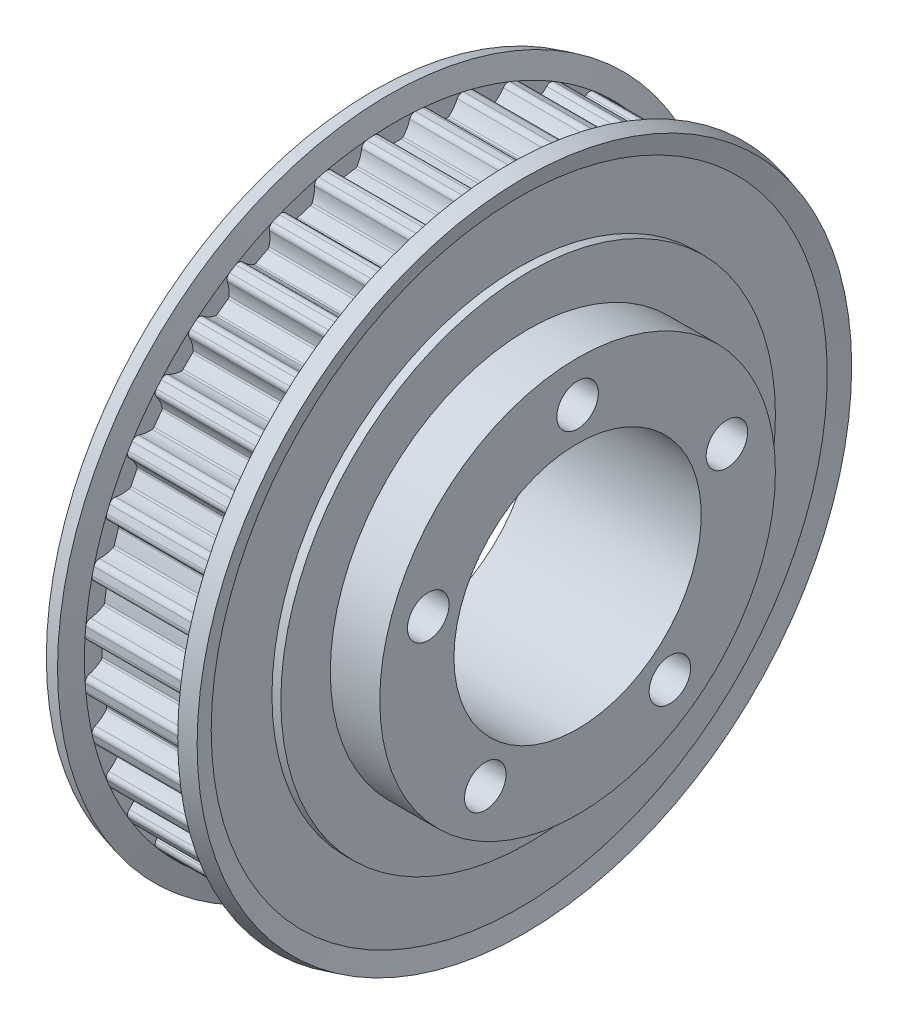
from build123d import *

# Parameters (mm, degrees)
SKETCH2_W             = 21
SKETCH2_H             = 12.5
CUT_EXTRUDE1_DEPTH    = 11
CUT_EXTRUDE2_DEPTH    = 11
CUT_EXTRUDE3_DEPTH    = 11
CUT_EXTRUDE4_DEPTH    = 11
CUT_EXTRUDE5_DEPTH    = 11
CUT_EXTRUDE6_DEPTH    = 11
CUT_EXTRUDE7_DEPTH    = 11
CUT_EXTRUDE8_DEPTH    = 11
CUT_EXTRUDE9_DEPTH    = 11
CUT_EXTRUDE10_DEPTH   = 11
CUT_EXTRUDE11_DEPTH   = 11
CUT_EXTRUDE12_DEPTH   = 11
CUT_EXTRUDE13_DEPTH   = 11
CUT_EXTRUDE14_DEPTH   = 11
CUT_EXTRUDE15_DEPTH   = 11
CUT_EXTRUDE16_DEPTH   = 11
CUT_EXTRUDE17_DEPTH   = 11
CUT_EXTRUDE18_DEPTH   = 11
CUT_EXTRUDE19_DEPTH   = 11
CUT_EXTRUDE20_DEPTH   = 11
CUT_EXTRUDE21_DEPTH   = 11
CUT_EXTRUDE22_DEPTH   = 11
CUT_EXTRUDE23_DEPTH   = 11
CUT_EXTRUDE24_DEPTH   = 11
CUT_EXTRUDE25_DEPTH   = 11
CUT_EXTRUDE26_DEPTH   = 11
CUT_EXTRUDE27_DEPTH   = 11
CUT_EXTRUDE28_DEPTH   = 11
CUT_EXTRUDE29_DEPTH   = 11
CUT_EXTRUDE30_DEPTH   = 11
CUT_EXTRUDE31_DEPTH   = 11
CUT_EXTRUDE32_DEPTH   = 11
CUT_EXTRUDE33_DEPTH   = 11
CUT_EXTRUDE34_DEPTH   = 11
CUT_EXTRUDE35_DEPTH   = 11
CUT_EXTRUDE36_DEPTH   = 11
CUT_EXTRUDE37_DEPTH   = 11
CUT_EXTRUDE38_DEPTH   = 11
CUT_EXTRUDE39_DEPTH   = 11
CUT_EXTRUDE40_DEPTH   = 11
SKETCH43_W            = 5
SKETCH43_H            = 3.5
M5X0_8_TAPPED_HOLE1_D = 4.2
CIRPATTERN1_COUNT     = 5
SKETCH47_R            = 21
CUT_EXTRUDE41_DEPTH   = 4


with BuildPart() as part:
    # Sketch1 → Revolve1 (revolve)
    with BuildSketch(Plane.XY):
        Polygon((0, 0), (0, 25), (0.9, 25), (0.9, 31.139356004), (0.378427914, 33.085889528), (1.923909236, 33.5), (2.5, 31.35), (13.5, 31.35), (14.076090764, 33.5), (15.621572086, 33.085889528), (15.1, 31.139356004), (15.1, 25), (16, 25), (16, 23.5), (21, 23.5), (21, 0), align=None)
    revolve(axis=Axis((21, 0, 0), (-1, 0, 0)))

    # Sketch2 → Cut-Revolve1 (revolve, cut)
    with BuildSketch(Plane.XY):
        with Locations((10.5, 6.25)):
            Rectangle(SKETCH2_W, SKETCH2_H)
    revolve(axis=Axis((21, 0, 0), (-1, 0, 0)), mode=Mode.SUBTRACT)

    # Sketch3 → Cut-Extrude1 (cut)
    with BuildSketch(Plane(origin=(2.5, 0, 0), x_dir=(0, 0, -1), z_dir=(1, 0, 0))):
        with BuildLine():
            Line((2.087720208, 31.280407995), (2.087720208, 31.761459732))
            ThreePointArc((2.087720208, 31.761459732), (0, 31.83), (-2.087720208, 31.761459732))
            Line((-2.087720208, 31.761459732), (-2.087720208, 31.280407995))
            ThreePointArc((-2.087720208, 31.280407995), (-1.735068973, 31.181771634), (-1.522504924, 30.883596266))
            ThreePointArc((-1.522504924, 30.883596266), (-1.258864332, 30.23641307), (-0.863917433, 29.659898198))
            ThreePointArc((-0.863917433, 29.659898198), (-0.775941477, 29.594148784), (-0.668275681, 29.572450146))
            ThreePointArc((-0.668275681, 29.572450146), (9e-09, 29.58), (0.668275699, 29.572450145))
            ThreePointArc((0.668275699, 29.572450145), (0.775941485, 29.594148787), (0.863917433, 29.659898198))
            ThreePointArc((0.863917433, 29.659898198), (1.258864332, 30.23641307), (1.522504924, 30.883596266))
            ThreePointArc((1.522504924, 30.883596266), (1.735068973, 31.181771634), (2.087720208, 31.280407995))
        make_face()
    extrude(amount=CUT_EXTRUDE1_DEPTH, mode=Mode.SUBTRACT)

    # Sketch4 → Cut-Extrude2 (cut)
    with BuildSketch(Plane(origin=(2.5, 0, 0), x_dir=(0, 0, -1), z_dir=(1, 0, 0))):
        with BuildLine():
            Line((6.955350799, 30.568702872), (7.03060387, 31.043832064))
            ThreePointArc((7.03060387, 31.043832064), (4.979309022, 31.438119881), (2.906570055, 31.697014852))
            Line((2.906570055, 31.697014852), (2.831316983, 31.22188566))
            ThreePointArc((2.831316983, 31.22188566), (3.16419637, 31.069296869), (3.327498498, 30.741540191))
            ThreePointArc((3.327498498, 30.741540191), (3.48665148, 30.061082419), (3.786549132, 29.429882095))
            ThreePointArc((3.786549132, 29.429882095), (3.863156484, 29.351179693), (3.96610232, 29.31290556))
            ThreePointArc((3.96610232, 29.31290556), (4.627331485, 29.215821113), (5.286198535, 29.10382286))
            ThreePointArc((5.286198535, 29.10382286), (5.395933191, 29.108411716), (5.493111483, 29.159589172))
            ThreePointArc((5.493111483, 29.159589172), (5.973382727, 29.667222882), (6.335019222, 30.265195704))
            ThreePointArc((6.335019222, 30.265195704), (6.591611159, 30.526447696), (6.955350799, 30.568702872))
        make_face()
    extrude(amount=CUT_EXTRUDE2_DEPTH, mode=Mode.SUBTRACT)

    # Sketch5 → Cut-Extrude3 (cut)
    with BuildSketch(Plane(origin=(2.5, 0, 0), x_dir=(0, 0, -1), z_dir=(1, 0, 0))):
        with BuildLine():
            Line((11.651717569, 29.104294832), (11.800370731, 29.561802222))
            ThreePointArc((11.800370731, 29.561802222), (9.836010931, 30.272128914), (7.829290916, 30.852084269))
            Line((7.829290916, 30.852084269), (7.680637754, 30.39457688))
            ThreePointArc((7.680637754, 30.39457688), (7.985548697, 30.191792901), (8.095567864, 29.842525371))
            ThreePointArc((8.095567864, 29.842525371), (8.146314361, 29.145548152), (8.343778291, 28.475204623))
            ThreePointArc((8.343778291, 28.475204623), (8.407130711, 28.385487148), (8.502821719, 28.331579956))
            ThreePointArc((8.502821719, 28.331579956), (9.140722702, 28.132251749), (9.773957618, 27.918562865))
            ThreePointArc((9.773957618, 27.918562865), (9.883059115, 27.905928943), (9.987046899, 27.941274286))
            ThreePointArc((9.987046899, 27.941274286), (10.540816614, 28.367527207), (10.991544323, 28.901565579))
            ThreePointArc((10.991544323, 28.901565579), (11.285846002, 29.119461303), (11.651717569, 29.104294832))
        make_face()
    extrude(amount=CUT_EXTRUDE3_DEPTH, mode=Mode.SUBTRACT)

    # Sketch6 → Cut-Extrude4 (cut)
    with BuildSketch(Plane(origin=(2.5, 0, 0), x_dir=(0, 0, -1), z_dir=(1, 0, 0))):
        with BuildLine():
            Line((16.061180383, 26.923242462), (16.279573302, 27.351862699))
            ThreePointArc((16.279573302, 27.351862699), (14.450517607, 28.360737665), (12.559228651, 29.24747298))
            Line((12.559228651, 29.24747298), (12.340835732, 28.818852743))
            ThreePointArc((12.340835732, 28.818852743), (12.610270312, 28.570866792), (12.664297482, 28.208688534))
            ThreePointArc((12.664297482, 28.208688534), (12.605387947, 27.512353761), (12.695555936, 26.819373109))
            ThreePointArc((12.695555936, 26.819373109), (12.744093478, 26.720849703), (12.830173428, 26.652636826))
            ThreePointArc((12.830173428, 26.652636826), (13.42903899, 26.355972981), (14.021049428, 26.045855197))
            ThreePointArc((14.021049428, 26.045855197), (14.126831323, 26.016309585), (14.235068074, 26.034952494))
            ThreePointArc((14.235068074, 26.034952494), (14.848700613, 26.369328866), (15.377421123, 26.826282992))
            ThreePointArc((15.377421123, 26.826282992), (15.702185862, 26.995457132), (16.061180383, 26.923242462))
        make_face()
    extrude(amount=CUT_EXTRUDE4_DEPTH, mode=Mode.SUBTRACT)

    # Sketch7 → Cut-Extrude5 (cut)
    with BuildSketch(Plane(origin=(2.5, 0, 0), x_dir=(0, 0, -1), z_dir=(1, 0, 0))):
        with BuildLine():
            Line((20.075163633, 24.07925051), (20.35791875, 24.468429541))
            ThreePointArc((20.35791875, 24.468429541), (18.70920458, 25.751010931), (16.979916494, 26.922691839))
            Line((16.979916494, 26.922691839), (16.697161378, 26.533512808))
            ThreePointArc((16.697161378, 26.533512808), (16.924485222, 26.246431121), (16.921190065, 25.880260167))
            ThreePointArc((16.921190065, 25.880260167), (16.754075046, 25.201713912), (16.73472686, 24.50315962))
            ThreePointArc((16.73472686, 24.50315962), (16.767254368, 24.398256257), (16.841603687, 24.317417323))
            ThreePointArc((16.841603687, 24.317417323), (17.38668777, 23.930722688), (17.922896467, 23.531812132))
            ThreePointArc((17.922896467, 23.531812132), (18.022754059, 23.486082341), (18.13257463, 23.487563768))
            ThreePointArc((18.13257463, 23.487563768), (18.790960323, 23.721830133), (19.38465478, 24.090448285))
            ThreePointArc((19.38465478, 24.090448285), (19.731885792, 24.206735213), (20.075163633, 24.07925051))
        make_face()
    extrude(amount=CUT_EXTRUDE5_DEPTH, mode=Mode.SUBTRACT)

    # Sketch8 → Cut-Extrude6 (cut)
    with BuildSketch(Plane(origin=(2.5, 0, 0), x_dir=(0, 0, -1), z_dir=(1, 0, 0))):
        with BuildLine():
            Line((23.594829728, 20.642347495), (23.934984673, 20.982502441))
            ThreePointArc((23.934984673, 20.982502441), (22.507208845, 22.507208845), (20.982502441, 23.934984673))
            Line((20.982502441, 23.934984673), (20.642347495, 23.594829728))
            ThreePointArc((20.642347495, 23.594829728), (20.821963136, 23.275721208), (20.761426791, 22.914573903))
            ThreePointArc((20.761426791, 22.914573903), (20.490221215, 22.270524226), (20.36183327, 21.58359702))
            ThreePointArc((20.36183327, 21.58359702), (20.377549808, 21.474896768), (20.438337768, 21.3834223))
            ThreePointArc((20.438337768, 21.3834223), (20.916218594, 20.916218581), (21.383422312, 20.438337755))
            ThreePointArc((21.383422312, 20.438337755), (21.474896777, 20.377549805), (21.58359702, 20.36183327))
            ThreePointArc((21.58359702, 20.36183327), (22.270524226, 20.490221215), (22.914573903, 20.761426791))
            ThreePointArc((22.914573903, 20.761426791), (23.275721208, 20.821963136), (23.594829728, 20.642347495))
        make_face()
    extrude(amount=CUT_EXTRUDE6_DEPTH, mode=Mode.SUBTRACT)

    # Sketch9 → Cut-Extrude7 (cut)
    with BuildSketch(Plane(origin=(2.5, 0, 0), x_dir=(0, 0, -1), z_dir=(1, 0, 0))):
        with BuildLine():
            Line((26.533512808, 16.697161378), (26.922691839, 16.979916494))
            ThreePointArc((26.922691839, 16.979916494), (25.751010931, 18.70920458), (24.468429541, 20.35791875))
            Line((24.468429541, 20.35791875), (24.07925051, 20.075163633))
            ThreePointArc((24.07925051, 20.075163633), (24.206735213, 19.731885792), (24.090448285, 19.38465478))
            ThreePointArc((24.090448285, 19.38465478), (23.721830133, 18.790960323), (23.487563768, 18.13257463))
            ThreePointArc((23.487563768, 18.13257463), (23.486082343, 18.02275405), (23.531812143, 17.922896453))
            ThreePointArc((23.531812143, 17.922896453), (23.930722699, 17.386687756), (24.317417333, 16.841603672))
            ThreePointArc((24.317417333, 16.841603672), (24.398256264, 16.767254363), (24.50315962, 16.73472686))
            ThreePointArc((24.50315962, 16.73472686), (25.201713912, 16.754075046), (25.880260167, 16.921190065))
            ThreePointArc((25.880260167, 16.921190065), (26.246431121, 16.924485222), (26.533512808, 16.697161378))
        make_face()
    extrude(amount=CUT_EXTRUDE7_DEPTH, mode=Mode.SUBTRACT)

    # Sketch10 → Cut-Extrude8 (cut)
    with BuildSketch(Plane(origin=(2.5, 0, 0), x_dir=(0, 0, -1), z_dir=(1, 0, 0))):
        with BuildLine():
            Line((28.818852743, 12.340835732), (29.24747298, 12.559228651))
            ThreePointArc((29.24747298, 12.559228651), (28.360737665, 14.450517607), (27.351862699, 16.279573302))
            Line((27.351862699, 16.279573302), (26.923242462, 16.061180383))
            ThreePointArc((26.923242462, 16.061180383), (26.995457132, 15.702185862), (26.826282992, 15.377421123))
            ThreePointArc((26.826282992, 15.377421123), (26.369328866, 14.848700613), (26.034952494, 14.235068074))
            ThreePointArc((26.034952494, 14.235068074), (26.016309585, 14.126831314), (26.045855205, 14.021049412))
            ThreePointArc((26.045855205, 14.021049412), (26.35597299, 13.429038974), (26.652636834, 12.830173412))
            ThreePointArc((26.652636834, 12.830173412), (26.72084971, 12.744093472), (26.819373109, 12.695555936))
            ThreePointArc((26.819373109, 12.695555936), (27.512353761, 12.605387947), (28.208688534, 12.664297482))
            ThreePointArc((28.208688534, 12.664297482), (28.570866792, 12.610270312), (28.818852743, 12.340835732))
        make_face()
    extrude(amount=CUT_EXTRUDE8_DEPTH, mode=Mode.SUBTRACT)

    # Sketch11 → Cut-Extrude9 (cut)
    with BuildSketch(Plane(origin=(2.5, 0, 0), x_dir=(0, 0, -1), z_dir=(1, 0, 0))):
        with BuildLine():
            Line((30.39457688, 7.680637754), (30.852084269, 7.829290916))
            ThreePointArc((30.852084269, 7.829290916), (30.272128914, 9.836010931), (29.561802222, 11.800370731))
            Line((29.561802222, 11.800370731), (29.104294832, 11.651717569))
            ThreePointArc((29.104294832, 11.651717569), (29.119461303, 11.285846002), (28.901565579, 10.991544323))
            ThreePointArc((28.901565579, 10.991544323), (28.367527207, 10.540816614), (27.941274286, 9.987046899))
            ThreePointArc((27.941274286, 9.987046899), (27.905928942, 9.883059106), (27.918562871, 9.773957602))
            ThreePointArc((27.918562871, 9.773957602), (28.132251755, 9.140722685), (28.331579961, 8.502821702))
            ThreePointArc((28.331579961, 8.502821702), (28.385487154, 8.407130704), (28.475204623, 8.343778291))
            ThreePointArc((28.475204623, 8.343778291), (29.145548152, 8.146314361), (29.842525371, 8.095567864))
            ThreePointArc((29.842525371, 8.095567864), (30.191792901, 7.985548697), (30.39457688, 7.680637754))
        make_face()
    extrude(amount=CUT_EXTRUDE9_DEPTH, mode=Mode.SUBTRACT)

    # Sketch12 → Cut-Extrude10 (cut)
    with BuildSketch(Plane(origin=(2.5, 0, 0), x_dir=(0, 0, -1), z_dir=(1, 0, 0))):
        with BuildLine():
            Line((31.22188566, 2.831316983), (31.697014852, 2.906570055))
            ThreePointArc((31.697014852, 2.906570055), (31.438119881, 4.979309022), (31.043832064, 7.03060387))
            Line((31.043832064, 7.03060387), (30.568702872, 6.955350799))
            ThreePointArc((30.568702872, 6.955350799), (30.526447696, 6.591611159), (30.265195704, 6.335019222))
            ThreePointArc((30.265195704, 6.335019222), (29.667222882, 5.973382727), (29.159589172, 5.493111483))
            ThreePointArc((29.159589172, 5.493111483), (29.108411714, 5.395933183), (29.103822863, 5.286198517))
            ThreePointArc((29.103822863, 5.286198517), (29.215821116, 4.627331467), (29.312905563, 3.966102302))
            ThreePointArc((29.312905563, 3.966102302), (29.351179698, 3.863156476), (29.429882095, 3.786549132))
            ThreePointArc((29.429882095, 3.786549132), (30.061082419, 3.48665148), (30.741540191, 3.327498498))
            ThreePointArc((30.741540191, 3.327498498), (31.069296869, 3.16419637), (31.22188566, 2.831316983))
        make_face()
    extrude(amount=CUT_EXTRUDE10_DEPTH, mode=Mode.SUBTRACT)

    # Sketch13 → Cut-Extrude11 (cut)
    with BuildSketch(Plane(origin=(2.5, 0, 0), x_dir=(0, 0, -1), z_dir=(1, 0, 0))):
        with BuildLine():
            Line((31.280407995, -2.087720208), (31.761459732, -2.087720208))
            ThreePointArc((31.761459732, -2.087720208), (31.83, 0), (31.761459732, 2.087720208))
            Line((31.761459732, 2.087720208), (31.280407995, 2.087720208))
            ThreePointArc((31.280407995, 2.087720208), (31.181771634, 1.735068973), (30.883596266, 1.522504924))
            ThreePointArc((30.883596266, 1.522504924), (30.23641307, 1.258864332), (29.659898198, 0.863917433))
            ThreePointArc((29.659898198, 0.863917433), (29.594148784, 0.775941477), (29.572450146, 0.668275681))
            ThreePointArc((29.572450146, 0.668275681), (29.58, -9e-09), (29.572450145, -0.668275699))
            ThreePointArc((29.572450145, -0.668275699), (29.594148787, -0.775941485), (29.659898198, -0.863917433))
            ThreePointArc((29.659898198, -0.863917433), (30.23641307, -1.258864332), (30.883596266, -1.522504924))
            ThreePointArc((30.883596266, -1.522504924), (31.181771634, -1.735068973), (31.280407995, -2.087720208))
        make_face()
    extrude(amount=CUT_EXTRUDE11_DEPTH, mode=Mode.SUBTRACT)

    # Sketch14 → Cut-Extrude12 (cut)
    with BuildSketch(Plane(origin=(2.5, 0, 0), x_dir=(0, 0, -1), z_dir=(1, 0, 0))):
        with BuildLine():
            Line((30.568702872, -6.955350799), (31.043832064, -7.03060387))
            ThreePointArc((31.043832064, -7.03060387), (31.438119881, -4.979309022), (31.697014852, -2.906570055))
            Line((31.697014852, -2.906570055), (31.22188566, -2.831316983))
            ThreePointArc((31.22188566, -2.831316983), (31.069296869, -3.16419637), (30.741540191, -3.327498498))
            ThreePointArc((30.741540191, -3.327498498), (30.061082419, -3.48665148), (29.429882095, -3.786549132))
            ThreePointArc((29.429882095, -3.786549132), (29.351179693, -3.863156484), (29.31290556, -3.96610232))
            ThreePointArc((29.31290556, -3.96610232), (29.215821113, -4.627331485), (29.10382286, -5.286198535))
            ThreePointArc((29.10382286, -5.286198535), (29.108411716, -5.395933191), (29.159589172, -5.493111483))
            ThreePointArc((29.159589172, -5.493111483), (29.667222882, -5.973382727), (30.265195704, -6.335019222))
            ThreePointArc((30.265195704, -6.335019222), (30.526447696, -6.591611159), (30.568702872, -6.955350799))
        make_face()
    extrude(amount=CUT_EXTRUDE12_DEPTH, mode=Mode.SUBTRACT)

    # Sketch15 → Cut-Extrude13 (cut)
    with BuildSketch(Plane(origin=(2.5, 0, 0), x_dir=(0, 0, -1), z_dir=(1, 0, 0))):
        with BuildLine():
            Line((29.104294832, -11.651717569), (29.561802222, -11.800370731))
            ThreePointArc((29.561802222, -11.800370731), (30.272128914, -9.836010931), (30.852084269, -7.829290916))
            Line((30.852084269, -7.829290916), (30.39457688, -7.680637754))
            ThreePointArc((30.39457688, -7.680637754), (30.191792901, -7.985548697), (29.842525371, -8.095567864))
            ThreePointArc((29.842525371, -8.095567864), (29.145548152, -8.146314361), (28.475204623, -8.343778291))
            ThreePointArc((28.475204623, -8.343778291), (28.385487148, -8.407130711), (28.331579956, -8.502821719))
            ThreePointArc((28.331579956, -8.502821719), (28.132251749, -9.140722702), (27.918562865, -9.773957618))
            ThreePointArc((27.918562865, -9.773957618), (27.905928943, -9.883059115), (27.941274286, -9.987046899))
            ThreePointArc((27.941274286, -9.987046899), (28.367527207, -10.540816614), (28.901565579, -10.991544323))
            ThreePointArc((28.901565579, -10.991544323), (29.119461303, -11.285846002), (29.104294832, -11.651717569))
        make_face()
    extrude(amount=CUT_EXTRUDE13_DEPTH, mode=Mode.SUBTRACT)

    # Sketch16 → Cut-Extrude14 (cut)
    with BuildSketch(Plane(origin=(2.5, 0, 0), x_dir=(0, 0, -1), z_dir=(1, 0, 0))):
        with BuildLine():
            Line((26.923242462, -16.061180383), (27.351862699, -16.279573302))
            ThreePointArc((27.351862699, -16.279573302), (28.360737665, -14.450517607), (29.24747298, -12.559228651))
            Line((29.24747298, -12.559228651), (28.818852743, -12.340835732))
            ThreePointArc((28.818852743, -12.340835732), (28.570866792, -12.610270312), (28.208688534, -12.664297482))
            ThreePointArc((28.208688534, -12.664297482), (27.512353761, -12.605387947), (26.819373109, -12.695555936))
            ThreePointArc((26.819373109, -12.695555936), (26.720849703, -12.744093478), (26.652636826, -12.830173428))
            ThreePointArc((26.652636826, -12.830173428), (26.355972981, -13.42903899), (26.045855197, -14.021049428))
            ThreePointArc((26.045855197, -14.021049428), (26.016309585, -14.126831323), (26.034952494, -14.235068074))
            ThreePointArc((26.034952494, -14.235068074), (26.369328866, -14.848700613), (26.826282992, -15.377421123))
            ThreePointArc((26.826282992, -15.377421123), (26.995457132, -15.702185862), (26.923242462, -16.061180383))
        make_face()
    extrude(amount=CUT_EXTRUDE14_DEPTH, mode=Mode.SUBTRACT)

    # Sketch17 → Cut-Extrude15 (cut)
    with BuildSketch(Plane(origin=(2.5, 0, 0), x_dir=(0, 0, -1), z_dir=(1, 0, 0))):
        with BuildLine():
            Line((24.07925051, -20.075163633), (24.468429541, -20.35791875))
            ThreePointArc((24.468429541, -20.35791875), (25.751010931, -18.70920458), (26.922691839, -16.979916494))
            Line((26.922691839, -16.979916494), (26.533512808, -16.697161378))
            ThreePointArc((26.533512808, -16.697161378), (26.246431121, -16.924485222), (25.880260167, -16.921190065))
            ThreePointArc((25.880260167, -16.921190065), (25.201713912, -16.754075046), (24.50315962, -16.73472686))
            ThreePointArc((24.50315962, -16.73472686), (24.398256257, -16.767254368), (24.317417323, -16.841603687))
            ThreePointArc((24.317417323, -16.841603687), (23.930722688, -17.38668777), (23.531812132, -17.922896467))
            ThreePointArc((23.531812132, -17.922896467), (23.486082341, -18.022754059), (23.487563768, -18.13257463))
            ThreePointArc((23.487563768, -18.13257463), (23.721830133, -18.790960323), (24.090448285, -19.38465478))
            ThreePointArc((24.090448285, -19.38465478), (24.206735213, -19.731885792), (24.07925051, -20.075163633))
        make_face()
    extrude(amount=CUT_EXTRUDE15_DEPTH, mode=Mode.SUBTRACT)

    # Sketch18 → Cut-Extrude16 (cut)
    with BuildSketch(Plane(origin=(2.5, 0, 0), x_dir=(0, 0, -1), z_dir=(1, 0, 0))):
        with BuildLine():
            Line((20.642347495, -23.594829728), (20.982502441, -23.934984673))
            ThreePointArc((20.982502441, -23.934984673), (22.507208845, -22.507208845), (23.934984673, -20.982502441))
            Line((23.934984673, -20.982502441), (23.594829728, -20.642347495))
            ThreePointArc((23.594829728, -20.642347495), (23.275721208, -20.821963136), (22.914573903, -20.761426791))
            ThreePointArc((22.914573903, -20.761426791), (22.270524226, -20.490221215), (21.58359702, -20.36183327))
            ThreePointArc((21.58359702, -20.36183327), (21.474896768, -20.377549808), (21.3834223, -20.438337768))
            ThreePointArc((21.3834223, -20.438337768), (20.916218581, -20.916218594), (20.438337755, -21.383422312))
            ThreePointArc((20.438337755, -21.383422312), (20.377549805, -21.474896777), (20.36183327, -21.58359702))
            ThreePointArc((20.36183327, -21.58359702), (20.490221215, -22.270524226), (20.761426791, -22.914573903))
            ThreePointArc((20.761426791, -22.914573903), (20.821963136, -23.275721208), (20.642347495, -23.594829728))
        make_face()
    extrude(amount=CUT_EXTRUDE16_DEPTH, mode=Mode.SUBTRACT)

    # Sketch19 → Cut-Extrude17 (cut)
    with BuildSketch(Plane(origin=(2.5, 0, 0), x_dir=(0, 0, -1), z_dir=(1, 0, 0))):
        with BuildLine():
            Line((16.697161378, -26.533512808), (16.979916494, -26.922691839))
            ThreePointArc((16.979916494, -26.922691839), (18.70920458, -25.751010931), (20.35791875, -24.468429541))
            Line((20.35791875, -24.468429541), (20.075163633, -24.07925051))
            ThreePointArc((20.075163633, -24.07925051), (19.731885792, -24.206735213), (19.38465478, -24.090448285))
            ThreePointArc((19.38465478, -24.090448285), (18.790960323, -23.721830133), (18.13257463, -23.487563768))
            ThreePointArc((18.13257463, -23.487563768), (18.02275405, -23.486082343), (17.922896453, -23.531812143))
            ThreePointArc((17.922896453, -23.531812143), (17.386687756, -23.930722699), (16.841603672, -24.317417333))
            ThreePointArc((16.841603672, -24.317417333), (16.767254363, -24.398256264), (16.73472686, -24.50315962))
            ThreePointArc((16.73472686, -24.50315962), (16.754075046, -25.201713912), (16.921190065, -25.880260167))
            ThreePointArc((16.921190065, -25.880260167), (16.924485222, -26.246431121), (16.697161378, -26.533512808))
        make_face()
    extrude(amount=CUT_EXTRUDE17_DEPTH, mode=Mode.SUBTRACT)

    # Sketch20 → Cut-Extrude18 (cut)
    with BuildSketch(Plane(origin=(2.5, 0, 0), x_dir=(0, 0, -1), z_dir=(1, 0, 0))):
        with BuildLine():
            Line((12.340835732, -28.818852743), (12.559228651, -29.24747298))
            ThreePointArc((12.559228651, -29.24747298), (14.450517607, -28.360737665), (16.279573302, -27.351862699))
            Line((16.279573302, -27.351862699), (16.061180383, -26.923242462))
            ThreePointArc((16.061180383, -26.923242462), (15.702185862, -26.995457132), (15.377421123, -26.826282992))
            ThreePointArc((15.377421123, -26.826282992), (14.848700613, -26.369328866), (14.235068074, -26.034952494))
            ThreePointArc((14.235068074, -26.034952494), (14.126831314, -26.016309585), (14.021049412, -26.045855205))
            ThreePointArc((14.021049412, -26.045855205), (13.429038974, -26.35597299), (12.830173412, -26.652636834))
            ThreePointArc((12.830173412, -26.652636834), (12.744093472, -26.72084971), (12.695555936, -26.819373109))
            ThreePointArc((12.695555936, -26.819373109), (12.605387947, -27.512353761), (12.664297482, -28.208688534))
            ThreePointArc((12.664297482, -28.208688534), (12.610270312, -28.570866792), (12.340835732, -28.818852743))
        make_face()
    extrude(amount=CUT_EXTRUDE18_DEPTH, mode=Mode.SUBTRACT)

    # Sketch21 → Cut-Extrude19 (cut)
    with BuildSketch(Plane(origin=(2.5, 0, 0), x_dir=(0, 0, -1), z_dir=(1, 0, 0))):
        with BuildLine():
            Line((7.680637754, -30.39457688), (7.829290916, -30.852084269))
            ThreePointArc((7.829290916, -30.852084269), (9.836010931, -30.272128914), (11.800370731, -29.561802222))
            Line((11.800370731, -29.561802222), (11.651717569, -29.104294832))
            ThreePointArc((11.651717569, -29.104294832), (11.285846002, -29.119461303), (10.991544323, -28.901565579))
            ThreePointArc((10.991544323, -28.901565579), (10.540816614, -28.367527207), (9.987046899, -27.941274286))
            ThreePointArc((9.987046899, -27.941274286), (9.883059106, -27.905928942), (9.773957602, -27.918562871))
            ThreePointArc((9.773957602, -27.918562871), (9.140722685, -28.132251755), (8.502821702, -28.331579961))
            ThreePointArc((8.502821702, -28.331579961), (8.407130704, -28.385487154), (8.343778291, -28.475204623))
            ThreePointArc((8.343778291, -28.475204623), (8.146314361, -29.145548152), (8.095567864, -29.842525371))
            ThreePointArc((8.095567864, -29.842525371), (7.985548697, -30.191792901), (7.680637754, -30.39457688))
        make_face()
    extrude(amount=CUT_EXTRUDE19_DEPTH, mode=Mode.SUBTRACT)

    # Sketch22 → Cut-Extrude20 (cut)
    with BuildSketch(Plane(origin=(2.5, 0, 0), x_dir=(0, 0, -1), z_dir=(1, 0, 0))):
        with BuildLine():
            Line((2.831316983, -31.22188566), (2.906570055, -31.697014852))
            ThreePointArc((2.906570055, -31.697014852), (4.979309022, -31.438119881), (7.03060387, -31.043832064))
            Line((7.03060387, -31.043832064), (6.955350799, -30.568702872))
            ThreePointArc((6.955350799, -30.568702872), (6.591611159, -30.526447696), (6.335019222, -30.265195704))
            ThreePointArc((6.335019222, -30.265195704), (5.973382727, -29.667222882), (5.493111483, -29.159589172))
            ThreePointArc((5.493111483, -29.159589172), (5.395933183, -29.108411714), (5.286198517, -29.103822863))
            ThreePointArc((5.286198517, -29.103822863), (4.627331467, -29.215821116), (3.966102302, -29.312905563))
            ThreePointArc((3.966102302, -29.312905563), (3.863156476, -29.351179698), (3.786549132, -29.429882095))
            ThreePointArc((3.786549132, -29.429882095), (3.48665148, -30.061082419), (3.327498498, -30.741540191))
            ThreePointArc((3.327498498, -30.741540191), (3.16419637, -31.069296869), (2.831316983, -31.22188566))
        make_face()
    extrude(amount=CUT_EXTRUDE20_DEPTH, mode=Mode.SUBTRACT)

    # Sketch23 → Cut-Extrude21 (cut)
    with BuildSketch(Plane(origin=(2.5, 0, 0), x_dir=(0, 0, -1), z_dir=(1, 0, 0))):
        with BuildLine():
            Line((-2.087720208, -31.280407995), (-2.087720208, -31.761459732))
            ThreePointArc((-2.087720208, -31.761459732), (0, -31.83), (2.087720208, -31.761459732))
            Line((2.087720208, -31.761459732), (2.087720208, -31.280407995))
            ThreePointArc((2.087720208, -31.280407995), (1.735068973, -31.181771634), (1.522504924, -30.883596266))
            ThreePointArc((1.522504924, -30.883596266), (1.258864332, -30.23641307), (0.863917433, -29.659898198))
            ThreePointArc((0.863917433, -29.659898198), (0.775941477, -29.594148784), (0.668275681, -29.572450146))
            ThreePointArc((0.668275681, -29.572450146), (-9e-09, -29.58), (-0.668275699, -29.572450145))
            ThreePointArc((-0.668275699, -29.572450145), (-0.775941485, -29.594148787), (-0.863917433, -29.659898198))
            ThreePointArc((-0.863917433, -29.659898198), (-1.258864332, -30.23641307), (-1.522504924, -30.883596266))
            ThreePointArc((-1.522504924, -30.883596266), (-1.735068973, -31.181771634), (-2.087720208, -31.280407995))
        make_face()
    extrude(amount=CUT_EXTRUDE21_DEPTH, mode=Mode.SUBTRACT)

    # Sketch24 → Cut-Extrude22 (cut)
    with BuildSketch(Plane(origin=(2.5, 0, 0), x_dir=(0, 0, -1), z_dir=(1, 0, 0))):
        with BuildLine():
            Line((-6.955350799, -30.568702872), (-7.03060387, -31.043832064))
            ThreePointArc((-7.03060387, -31.043832064), (-4.979309022, -31.438119881), (-2.906570055, -31.697014852))
            Line((-2.906570055, -31.697014852), (-2.831316983, -31.22188566))
            ThreePointArc((-2.831316983, -31.22188566), (-3.16419637, -31.069296869), (-3.327498498, -30.741540191))
            ThreePointArc((-3.327498498, -30.741540191), (-3.48665148, -30.061082419), (-3.786549132, -29.429882095))
            ThreePointArc((-3.786549132, -29.429882095), (-3.863156484, -29.351179693), (-3.96610232, -29.31290556))
            ThreePointArc((-3.96610232, -29.31290556), (-4.627331485, -29.215821113), (-5.286198535, -29.10382286))
            ThreePointArc((-5.286198535, -29.10382286), (-5.395933191, -29.108411716), (-5.493111483, -29.159589172))
            ThreePointArc((-5.493111483, -29.159589172), (-5.973382727, -29.667222882), (-6.335019222, -30.265195704))
            ThreePointArc((-6.335019222, -30.265195704), (-6.591611159, -30.526447696), (-6.955350799, -30.568702872))
        make_face()
    extrude(amount=CUT_EXTRUDE22_DEPTH, mode=Mode.SUBTRACT)

    # Sketch25 → Cut-Extrude23 (cut)
    with BuildSketch(Plane(origin=(2.5, 0, 0), x_dir=(0, 0, -1), z_dir=(1, 0, 0))):
        with BuildLine():
            Line((-11.651717569, -29.104294832), (-11.800370731, -29.561802222))
            ThreePointArc((-11.800370731, -29.561802222), (-9.836010931, -30.272128914), (-7.829290916, -30.852084269))
            Line((-7.829290916, -30.852084269), (-7.680637754, -30.39457688))
            ThreePointArc((-7.680637754, -30.39457688), (-7.985548697, -30.191792901), (-8.095567864, -29.842525371))
            ThreePointArc((-8.095567864, -29.842525371), (-8.146314361, -29.145548152), (-8.343778291, -28.475204623))
            ThreePointArc((-8.343778291, -28.475204623), (-8.407130711, -28.385487148), (-8.502821719, -28.331579956))
            ThreePointArc((-8.502821719, -28.331579956), (-9.140722702, -28.132251749), (-9.773957618, -27.918562865))
            ThreePointArc((-9.773957618, -27.918562865), (-9.883059115, -27.905928943), (-9.987046899, -27.941274286))
            ThreePointArc((-9.987046899, -27.941274286), (-10.540816614, -28.367527207), (-10.991544323, -28.901565579))
            ThreePointArc((-10.991544323, -28.901565579), (-11.285846002, -29.119461303), (-11.651717569, -29.104294832))
        make_face()
    extrude(amount=CUT_EXTRUDE23_DEPTH, mode=Mode.SUBTRACT)

    # Sketch26 → Cut-Extrude24 (cut)
    with BuildSketch(Plane(origin=(2.5, 0, 0), x_dir=(0, 0, -1), z_dir=(1, 0, 0))):
        with BuildLine():
            Line((-16.061180383, -26.923242462), (-16.279573302, -27.351862699))
            ThreePointArc((-16.279573302, -27.351862699), (-14.450517607, -28.360737665), (-12.559228651, -29.24747298))
            Line((-12.559228651, -29.24747298), (-12.340835732, -28.818852743))
            ThreePointArc((-12.340835732, -28.818852743), (-12.610270312, -28.570866792), (-12.664297482, -28.208688534))
            ThreePointArc((-12.664297482, -28.208688534), (-12.605387947, -27.512353761), (-12.695555936, -26.819373109))
            ThreePointArc((-12.695555936, -26.819373109), (-12.744093478, -26.720849703), (-12.830173428, -26.652636826))
            ThreePointArc((-12.830173428, -26.652636826), (-13.42903899, -26.355972981), (-14.021049428, -26.045855197))
            ThreePointArc((-14.021049428, -26.045855197), (-14.126831323, -26.016309585), (-14.235068074, -26.034952494))
            ThreePointArc((-14.235068074, -26.034952494), (-14.848700613, -26.369328866), (-15.377421123, -26.826282992))
            ThreePointArc((-15.377421123, -26.826282992), (-15.702185862, -26.995457132), (-16.061180383, -26.923242462))
        make_face()
    extrude(amount=CUT_EXTRUDE24_DEPTH, mode=Mode.SUBTRACT)

    # Sketch27 → Cut-Extrude25 (cut)
    with BuildSketch(Plane(origin=(2.5, 0, 0), x_dir=(0, 0, -1), z_dir=(1, 0, 0))):
        with BuildLine():
            Line((-20.075163633, -24.07925051), (-20.35791875, -24.468429541))
            ThreePointArc((-20.35791875, -24.468429541), (-18.70920458, -25.751010931), (-16.979916494, -26.922691839))
            Line((-16.979916494, -26.922691839), (-16.697161378, -26.533512808))
            ThreePointArc((-16.697161378, -26.533512808), (-16.924485222, -26.246431121), (-16.921190065, -25.880260167))
            ThreePointArc((-16.921190065, -25.880260167), (-16.754075046, -25.201713912), (-16.73472686, -24.50315962))
            ThreePointArc((-16.73472686, -24.50315962), (-16.767254368, -24.398256257), (-16.841603687, -24.317417323))
            ThreePointArc((-16.841603687, -24.317417323), (-17.38668777, -23.930722688), (-17.922896467, -23.531812132))
            ThreePointArc((-17.922896467, -23.531812132), (-18.022754059, -23.486082341), (-18.13257463, -23.487563768))
            ThreePointArc((-18.13257463, -23.487563768), (-18.790960323, -23.721830133), (-19.38465478, -24.090448285))
            ThreePointArc((-19.38465478, -24.090448285), (-19.731885792, -24.206735213), (-20.075163633, -24.07925051))
        make_face()
    extrude(amount=CUT_EXTRUDE25_DEPTH, mode=Mode.SUBTRACT)

    # Sketch28 → Cut-Extrude26 (cut)
    with BuildSketch(Plane(origin=(2.5, 0, 0), x_dir=(0, 0, -1), z_dir=(1, 0, 0))):
        with BuildLine():
            Line((-23.594829728, -20.642347495), (-23.934984673, -20.982502441))
            ThreePointArc((-23.934984673, -20.982502441), (-22.507208845, -22.507208845), (-20.982502441, -23.934984673))
            Line((-20.982502441, -23.934984673), (-20.642347495, -23.594829728))
            ThreePointArc((-20.642347495, -23.594829728), (-20.821963136, -23.275721208), (-20.761426791, -22.914573903))
            ThreePointArc((-20.761426791, -22.914573903), (-20.490221215, -22.270524226), (-20.36183327, -21.58359702))
            ThreePointArc((-20.36183327, -21.58359702), (-20.377549808, -21.474896768), (-20.438337768, -21.3834223))
            ThreePointArc((-20.438337768, -21.3834223), (-20.916218594, -20.916218581), (-21.383422312, -20.438337755))
            ThreePointArc((-21.383422312, -20.438337755), (-21.474896777, -20.377549805), (-21.58359702, -20.36183327))
            ThreePointArc((-21.58359702, -20.36183327), (-22.270524226, -20.490221215), (-22.914573903, -20.761426791))
            ThreePointArc((-22.914573903, -20.761426791), (-23.275721208, -20.821963136), (-23.594829728, -20.642347495))
        make_face()
    extrude(amount=CUT_EXTRUDE26_DEPTH, mode=Mode.SUBTRACT)

    # Sketch29 → Cut-Extrude27 (cut)
    with BuildSketch(Plane(origin=(2.5, 0, 0), x_dir=(0, 0, -1), z_dir=(1, 0, 0))):
        with BuildLine():
            Line((-26.533512808, -16.697161378), (-26.922691839, -16.979916494))
            ThreePointArc((-26.922691839, -16.979916494), (-25.751010931, -18.70920458), (-24.468429541, -20.35791875))
            Line((-24.468429541, -20.35791875), (-24.07925051, -20.075163633))
            ThreePointArc((-24.07925051, -20.075163633), (-24.206735213, -19.731885792), (-24.090448285, -19.38465478))
            ThreePointArc((-24.090448285, -19.38465478), (-23.721830133, -18.790960323), (-23.487563768, -18.13257463))
            ThreePointArc((-23.487563768, -18.13257463), (-23.486082343, -18.02275405), (-23.531812143, -17.922896453))
            ThreePointArc((-23.531812143, -17.922896453), (-23.930722699, -17.386687756), (-24.317417333, -16.841603672))
            ThreePointArc((-24.317417333, -16.841603672), (-24.398256264, -16.767254363), (-24.50315962, -16.73472686))
            ThreePointArc((-24.50315962, -16.73472686), (-25.201713912, -16.754075046), (-25.880260167, -16.921190065))
            ThreePointArc((-25.880260167, -16.921190065), (-26.246431121, -16.924485222), (-26.533512808, -16.697161378))
        make_face()
    extrude(amount=CUT_EXTRUDE27_DEPTH, mode=Mode.SUBTRACT)

    # Sketch30 → Cut-Extrude28 (cut)
    with BuildSketch(Plane(origin=(2.5, 0, 0), x_dir=(0, 0, -1), z_dir=(1, 0, 0))):
        with BuildLine():
            Line((-28.818852743, -12.340835732), (-29.24747298, -12.559228651))
            ThreePointArc((-29.24747298, -12.559228651), (-28.360737665, -14.450517607), (-27.351862699, -16.279573302))
            Line((-27.351862699, -16.279573302), (-26.923242462, -16.061180383))
            ThreePointArc((-26.923242462, -16.061180383), (-26.995457132, -15.702185862), (-26.826282992, -15.377421123))
            ThreePointArc((-26.826282992, -15.377421123), (-26.369328866, -14.848700613), (-26.034952494, -14.235068074))
            ThreePointArc((-26.034952494, -14.235068074), (-26.016309585, -14.126831314), (-26.045855205, -14.021049412))
            ThreePointArc((-26.045855205, -14.021049412), (-26.35597299, -13.429038974), (-26.652636834, -12.830173412))
            ThreePointArc((-26.652636834, -12.830173412), (-26.72084971, -12.744093472), (-26.819373109, -12.695555936))
            ThreePointArc((-26.819373109, -12.695555936), (-27.512353761, -12.605387947), (-28.208688534, -12.664297482))
            ThreePointArc((-28.208688534, -12.664297482), (-28.570866792, -12.610270312), (-28.818852743, -12.340835732))
        make_face()
    extrude(amount=CUT_EXTRUDE28_DEPTH, mode=Mode.SUBTRACT)

    # Sketch31 → Cut-Extrude29 (cut)
    with BuildSketch(Plane(origin=(2.5, 0, 0), x_dir=(0, 0, -1), z_dir=(1, 0, 0))):
        with BuildLine():
            Line((-30.39457688, -7.680637754), (-30.852084269, -7.829290916))
            ThreePointArc((-30.852084269, -7.829290916), (-30.272128914, -9.836010931), (-29.561802222, -11.800370731))
            Line((-29.561802222, -11.800370731), (-29.104294832, -11.651717569))
            ThreePointArc((-29.104294832, -11.651717569), (-29.119461303, -11.285846002), (-28.901565579, -10.991544323))
            ThreePointArc((-28.901565579, -10.991544323), (-28.367527207, -10.540816614), (-27.941274286, -9.987046899))
            ThreePointArc((-27.941274286, -9.987046899), (-27.905928942, -9.883059106), (-27.918562871, -9.773957602))
            ThreePointArc((-27.918562871, -9.773957602), (-28.132251755, -9.140722685), (-28.331579961, -8.502821702))
            ThreePointArc((-28.331579961, -8.502821702), (-28.385487154, -8.407130704), (-28.475204623, -8.343778291))
            ThreePointArc((-28.475204623, -8.343778291), (-29.145548152, -8.146314361), (-29.842525371, -8.095567864))
            ThreePointArc((-29.842525371, -8.095567864), (-30.191792901, -7.985548697), (-30.39457688, -7.680637754))
        make_face()
    extrude(amount=CUT_EXTRUDE29_DEPTH, mode=Mode.SUBTRACT)

    # Sketch32 → Cut-Extrude30 (cut)
    with BuildSketch(Plane(origin=(2.5, 0, 0), x_dir=(0, 0, -1), z_dir=(1, 0, 0))):
        with BuildLine():
            Line((-31.22188566, -2.831316983), (-31.697014852, -2.906570055))
            ThreePointArc((-31.697014852, -2.906570055), (-31.438119881, -4.979309022), (-31.043832064, -7.03060387))
            Line((-31.043832064, -7.03060387), (-30.568702872, -6.955350799))
            ThreePointArc((-30.568702872, -6.955350799), (-30.526447696, -6.591611159), (-30.265195704, -6.335019222))
            ThreePointArc((-30.265195704, -6.335019222), (-29.667222882, -5.973382727), (-29.159589172, -5.493111483))
            ThreePointArc((-29.159589172, -5.493111483), (-29.108411714, -5.395933183), (-29.103822863, -5.286198517))
            ThreePointArc((-29.103822863, -5.286198517), (-29.215821116, -4.627331467), (-29.312905563, -3.966102302))
            ThreePointArc((-29.312905563, -3.966102302), (-29.351179698, -3.863156476), (-29.429882095, -3.786549132))
            ThreePointArc((-29.429882095, -3.786549132), (-30.061082419, -3.48665148), (-30.741540191, -3.327498498))
            ThreePointArc((-30.741540191, -3.327498498), (-31.069296869, -3.16419637), (-31.22188566, -2.831316983))
        make_face()
    extrude(amount=CUT_EXTRUDE30_DEPTH, mode=Mode.SUBTRACT)

    # Sketch33 → Cut-Extrude31 (cut)
    with BuildSketch(Plane(origin=(2.5, 0, 0), x_dir=(0, 0, -1), z_dir=(1, 0, 0))):
        with BuildLine():
            Line((-31.280407995, 2.087720208), (-31.761459732, 2.087720208))
            ThreePointArc((-31.761459732, 2.087720208), (-31.83, 0), (-31.761459732, -2.087720208))
            Line((-31.761459732, -2.087720208), (-31.280407995, -2.087720208))
            ThreePointArc((-31.280407995, -2.087720208), (-31.181771634, -1.735068973), (-30.883596266, -1.522504924))
            ThreePointArc((-30.883596266, -1.522504924), (-30.23641307, -1.258864332), (-29.659898198, -0.863917433))
            ThreePointArc((-29.659898198, -0.863917433), (-29.594148784, -0.775941477), (-29.572450146, -0.668275681))
            ThreePointArc((-29.572450146, -0.668275681), (-29.58, 9e-09), (-29.572450145, 0.668275699))
            ThreePointArc((-29.572450145, 0.668275699), (-29.594148787, 0.775941485), (-29.659898198, 0.863917433))
            ThreePointArc((-29.659898198, 0.863917433), (-30.23641307, 1.258864332), (-30.883596266, 1.522504924))
            ThreePointArc((-30.883596266, 1.522504924), (-31.181771634, 1.735068973), (-31.280407995, 2.087720208))
        make_face()
    extrude(amount=CUT_EXTRUDE31_DEPTH, mode=Mode.SUBTRACT)

    # Sketch34 → Cut-Extrude32 (cut)
    with BuildSketch(Plane(origin=(2.5, 0, 0), x_dir=(0, 0, -1), z_dir=(1, 0, 0))):
        with BuildLine():
            Line((-30.568702872, 6.955350799), (-31.043832064, 7.03060387))
            ThreePointArc((-31.043832064, 7.03060387), (-31.438119881, 4.979309022), (-31.697014852, 2.906570055))
            Line((-31.697014852, 2.906570055), (-31.22188566, 2.831316983))
            ThreePointArc((-31.22188566, 2.831316983), (-31.069296869, 3.16419637), (-30.741540191, 3.327498498))
            ThreePointArc((-30.741540191, 3.327498498), (-30.061082419, 3.48665148), (-29.429882095, 3.786549132))
            ThreePointArc((-29.429882095, 3.786549132), (-29.351179693, 3.863156484), (-29.31290556, 3.96610232))
            ThreePointArc((-29.31290556, 3.96610232), (-29.215821113, 4.627331485), (-29.10382286, 5.286198535))
            ThreePointArc((-29.10382286, 5.286198535), (-29.108411716, 5.395933191), (-29.159589172, 5.493111483))
            ThreePointArc((-29.159589172, 5.493111483), (-29.667222882, 5.973382727), (-30.265195704, 6.335019222))
            ThreePointArc((-30.265195704, 6.335019222), (-30.526447696, 6.591611159), (-30.568702872, 6.955350799))
        make_face()
    extrude(amount=CUT_EXTRUDE32_DEPTH, mode=Mode.SUBTRACT)

    # Sketch35 → Cut-Extrude33 (cut)
    with BuildSketch(Plane(origin=(2.5, 0, 0), x_dir=(0, 0, -1), z_dir=(1, 0, 0))):
        with BuildLine():
            Line((-29.104294832, 11.651717569), (-29.561802222, 11.800370731))
            ThreePointArc((-29.561802222, 11.800370731), (-30.272128914, 9.836010931), (-30.852084269, 7.829290916))
            Line((-30.852084269, 7.829290916), (-30.39457688, 7.680637754))
            ThreePointArc((-30.39457688, 7.680637754), (-30.191792901, 7.985548697), (-29.842525371, 8.095567864))
            ThreePointArc((-29.842525371, 8.095567864), (-29.145548152, 8.146314361), (-28.475204623, 8.343778291))
            ThreePointArc((-28.475204623, 8.343778291), (-28.385487148, 8.407130711), (-28.331579956, 8.502821719))
            ThreePointArc((-28.331579956, 8.502821719), (-28.132251749, 9.140722702), (-27.918562865, 9.773957618))
            ThreePointArc((-27.918562865, 9.773957618), (-27.905928943, 9.883059115), (-27.941274286, 9.987046899))
            ThreePointArc((-27.941274286, 9.987046899), (-28.367527207, 10.540816614), (-28.901565579, 10.991544323))
            ThreePointArc((-28.901565579, 10.991544323), (-29.119461303, 11.285846002), (-29.104294832, 11.651717569))
        make_face()
    extrude(amount=CUT_EXTRUDE33_DEPTH, mode=Mode.SUBTRACT)

    # Sketch36 → Cut-Extrude34 (cut)
    with BuildSketch(Plane(origin=(2.5, 0, 0), x_dir=(0, 0, -1), z_dir=(1, 0, 0))):
        with BuildLine():
            Line((-26.923242462, 16.061180383), (-27.351862699, 16.279573302))
            ThreePointArc((-27.351862699, 16.279573302), (-28.360737665, 14.450517607), (-29.24747298, 12.559228651))
            Line((-29.24747298, 12.559228651), (-28.818852743, 12.340835732))
            ThreePointArc((-28.818852743, 12.340835732), (-28.570866792, 12.610270312), (-28.208688534, 12.664297482))
            ThreePointArc((-28.208688534, 12.664297482), (-27.512353761, 12.605387947), (-26.819373109, 12.695555936))
            ThreePointArc((-26.819373109, 12.695555936), (-26.720849703, 12.744093478), (-26.652636826, 12.830173428))
            ThreePointArc((-26.652636826, 12.830173428), (-26.355972981, 13.42903899), (-26.045855197, 14.021049428))
            ThreePointArc((-26.045855197, 14.021049428), (-26.016309585, 14.126831323), (-26.034952494, 14.235068074))
            ThreePointArc((-26.034952494, 14.235068074), (-26.369328866, 14.848700613), (-26.826282992, 15.377421123))
            ThreePointArc((-26.826282992, 15.377421123), (-26.995457132, 15.702185862), (-26.923242462, 16.061180383))
        make_face()
    extrude(amount=CUT_EXTRUDE34_DEPTH, mode=Mode.SUBTRACT)

    # Sketch37 → Cut-Extrude35 (cut)
    with BuildSketch(Plane(origin=(2.5, 0, 0), x_dir=(0, 0, -1), z_dir=(1, 0, 0))):
        with BuildLine():
            Line((-24.07925051, 20.075163633), (-24.468429541, 20.35791875))
            ThreePointArc((-24.468429541, 20.35791875), (-25.751010931, 18.70920458), (-26.922691839, 16.979916494))
            Line((-26.922691839, 16.979916494), (-26.533512808, 16.697161378))
            ThreePointArc((-26.533512808, 16.697161378), (-26.246431121, 16.924485222), (-25.880260167, 16.921190065))
            ThreePointArc((-25.880260167, 16.921190065), (-25.201713912, 16.754075046), (-24.50315962, 16.73472686))
            ThreePointArc((-24.50315962, 16.73472686), (-24.398256257, 16.767254368), (-24.317417323, 16.841603687))
            ThreePointArc((-24.317417323, 16.841603687), (-23.930722688, 17.38668777), (-23.531812132, 17.922896467))
            ThreePointArc((-23.531812132, 17.922896467), (-23.486082341, 18.022754059), (-23.487563768, 18.13257463))
            ThreePointArc((-23.487563768, 18.13257463), (-23.721830133, 18.790960323), (-24.090448285, 19.38465478))
            ThreePointArc((-24.090448285, 19.38465478), (-24.206735213, 19.731885792), (-24.07925051, 20.075163633))
        make_face()
    extrude(amount=CUT_EXTRUDE35_DEPTH, mode=Mode.SUBTRACT)

    # Sketch38 → Cut-Extrude36 (cut)
    with BuildSketch(Plane(origin=(2.5, 0, 0), x_dir=(0, 0, -1), z_dir=(1, 0, 0))):
        with BuildLine():
            Line((-20.642347495, 23.594829728), (-20.982502441, 23.934984673))
            ThreePointArc((-20.982502441, 23.934984673), (-22.507208845, 22.507208845), (-23.934984673, 20.982502441))
            Line((-23.934984673, 20.982502441), (-23.594829728, 20.642347495))
            ThreePointArc((-23.594829728, 20.642347495), (-23.275721208, 20.821963136), (-22.914573903, 20.761426791))
            ThreePointArc((-22.914573903, 20.761426791), (-22.270524226, 20.490221215), (-21.58359702, 20.36183327))
            ThreePointArc((-21.58359702, 20.36183327), (-21.474896768, 20.377549808), (-21.3834223, 20.438337768))
            ThreePointArc((-21.3834223, 20.438337768), (-20.916218581, 20.916218594), (-20.438337755, 21.383422312))
            ThreePointArc((-20.438337755, 21.383422312), (-20.377549805, 21.474896777), (-20.36183327, 21.58359702))
            ThreePointArc((-20.36183327, 21.58359702), (-20.490221215, 22.270524226), (-20.761426791, 22.914573903))
            ThreePointArc((-20.761426791, 22.914573903), (-20.821963136, 23.275721208), (-20.642347495, 23.594829728))
        make_face()
    extrude(amount=CUT_EXTRUDE36_DEPTH, mode=Mode.SUBTRACT)

    # Sketch39 → Cut-Extrude37 (cut)
    with BuildSketch(Plane(origin=(2.5, 0, 0), x_dir=(0, 0, -1), z_dir=(1, 0, 0))):
        with BuildLine():
            Line((-16.697161378, 26.533512808), (-16.979916494, 26.922691839))
            ThreePointArc((-16.979916494, 26.922691839), (-18.70920458, 25.751010931), (-20.35791875, 24.468429541))
            Line((-20.35791875, 24.468429541), (-20.075163633, 24.07925051))
            ThreePointArc((-20.075163633, 24.07925051), (-19.731885792, 24.206735213), (-19.38465478, 24.090448285))
            ThreePointArc((-19.38465478, 24.090448285), (-18.790960323, 23.721830133), (-18.13257463, 23.487563768))
            ThreePointArc((-18.13257463, 23.487563768), (-18.02275405, 23.486082343), (-17.922896453, 23.531812143))
            ThreePointArc((-17.922896453, 23.531812143), (-17.386687756, 23.930722699), (-16.841603672, 24.317417333))
            ThreePointArc((-16.841603672, 24.317417333), (-16.767254363, 24.398256264), (-16.73472686, 24.50315962))
            ThreePointArc((-16.73472686, 24.50315962), (-16.754075046, 25.201713912), (-16.921190065, 25.880260167))
            ThreePointArc((-16.921190065, 25.880260167), (-16.924485222, 26.246431121), (-16.697161378, 26.533512808))
        make_face()
    extrude(amount=CUT_EXTRUDE37_DEPTH, mode=Mode.SUBTRACT)

    # Sketch40 → Cut-Extrude38 (cut)
    with BuildSketch(Plane(origin=(2.5, 0, 0), x_dir=(0, 0, -1), z_dir=(1, 0, 0))):
        with BuildLine():
            Line((-12.340835732, 28.818852743), (-12.559228651, 29.24747298))
            ThreePointArc((-12.559228651, 29.24747298), (-14.450517607, 28.360737665), (-16.279573302, 27.351862699))
            Line((-16.279573302, 27.351862699), (-16.061180383, 26.923242462))
            ThreePointArc((-16.061180383, 26.923242462), (-15.702185862, 26.995457132), (-15.377421123, 26.826282992))
            ThreePointArc((-15.377421123, 26.826282992), (-14.848700613, 26.369328866), (-14.235068074, 26.034952494))
            ThreePointArc((-14.235068074, 26.034952494), (-14.126831314, 26.016309585), (-14.021049412, 26.045855205))
            ThreePointArc((-14.021049412, 26.045855205), (-13.429038974, 26.35597299), (-12.830173412, 26.652636834))
            ThreePointArc((-12.830173412, 26.652636834), (-12.744093472, 26.72084971), (-12.695555936, 26.819373109))
            ThreePointArc((-12.695555936, 26.819373109), (-12.605387947, 27.512353761), (-12.664297482, 28.208688534))
            ThreePointArc((-12.664297482, 28.208688534), (-12.610270312, 28.570866792), (-12.340835732, 28.818852743))
        make_face()
    extrude(amount=CUT_EXTRUDE38_DEPTH, mode=Mode.SUBTRACT)

    # Sketch41 → Cut-Extrude39 (cut)
    with BuildSketch(Plane(origin=(2.5, 0, 0), x_dir=(0, 0, -1), z_dir=(1, 0, 0))):
        with BuildLine():
            Line((-7.680637754, 30.39457688), (-7.829290916, 30.852084269))
            ThreePointArc((-7.829290916, 30.852084269), (-9.836010931, 30.272128914), (-11.800370731, 29.561802222))
            Line((-11.800370731, 29.561802222), (-11.651717569, 29.104294832))
            ThreePointArc((-11.651717569, 29.104294832), (-11.285846002, 29.119461303), (-10.991544323, 28.901565579))
            ThreePointArc((-10.991544323, 28.901565579), (-10.540816614, 28.367527207), (-9.987046899, 27.941274286))
            ThreePointArc((-9.987046899, 27.941274286), (-9.883059106, 27.905928942), (-9.773957602, 27.918562871))
            ThreePointArc((-9.773957602, 27.918562871), (-9.140722685, 28.132251755), (-8.502821702, 28.331579961))
            ThreePointArc((-8.502821702, 28.331579961), (-8.407130704, 28.385487154), (-8.343778291, 28.475204623))
            ThreePointArc((-8.343778291, 28.475204623), (-8.146314361, 29.145548152), (-8.095567864, 29.842525371))
            ThreePointArc((-8.095567864, 29.842525371), (-7.985548697, 30.191792901), (-7.680637754, 30.39457688))
        make_face()
    extrude(amount=CUT_EXTRUDE39_DEPTH, mode=Mode.SUBTRACT)

    # Sketch42 → Cut-Extrude40 (cut)
    with BuildSketch(Plane(origin=(2.5, 0, 0), x_dir=(0, 0, -1), z_dir=(1, 0, 0))):
        with BuildLine():
            Line((-2.831316983, 31.22188566), (-2.906570055, 31.697014852))
            ThreePointArc((-2.906570055, 31.697014852), (-4.979309022, 31.438119881), (-7.03060387, 31.043832064))
            Line((-7.03060387, 31.043832064), (-6.955350799, 30.568702872))
            ThreePointArc((-6.955350799, 30.568702872), (-6.591611159, 30.526447696), (-6.335019222, 30.265195704))
            ThreePointArc((-6.335019222, 30.265195704), (-5.973382727, 29.667222882), (-5.493111483, 29.159589172))
            ThreePointArc((-5.493111483, 29.159589172), (-5.395933183, 29.108411714), (-5.286198517, 29.103822863))
            ThreePointArc((-5.286198517, 29.103822863), (-4.627331467, 29.215821116), (-3.966102302, 29.312905563))
            ThreePointArc((-3.966102302, 29.312905563), (-3.863156476, 29.351179698), (-3.786549132, 29.429882095))
            ThreePointArc((-3.786549132, 29.429882095), (-3.48665148, 30.061082419), (-3.327498498, 30.741540191))
            ThreePointArc((-3.327498498, 30.741540191), (-3.16419637, 31.069296869), (-2.831316983, 31.22188566))
        make_face()
    extrude(amount=CUT_EXTRUDE40_DEPTH, mode=Mode.SUBTRACT)

    # Sketch43 → Cut-Revolve2 (revolve, cut)
    with BuildSketch(Plane.XY):
        with Locations((18.5, 21.75)):
            Rectangle(SKETCH43_W, SKETCH43_H)
    revolve(axis=Axis((0, 0, 0), (1, 0, 0)), mode=Mode.SUBTRACT)

    # M5x0.8 Tapped Hole1 (through all)
    with Locations(Plane(origin=(21, 0, 0), x_dir=(0, 0, -1), z_dir=(1, 0, 0))):
        with Locations((0, 15.875)):
            m5x0_8_tapped_hole1 = Hole(M5X0_8_TAPPED_HOLE1_D / 2)

    # CirPattern1: M5x0.8 Tapped Hole1 ×5 about axis
    cirpattern1_axis = Axis((21, 0, 0), (-1, 0, 0))
    for i in range(1, CIRPATTERN1_COUNT):
        add(m5x0_8_tapped_hole1.rotate(cirpattern1_axis, i * 360 / CIRPATTERN1_COUNT), mode=Mode.SUBTRACT)

    # Sketch47 → Cut-Extrude41 (cut)
    with BuildSketch(Plane.ZY):
        Circle(SKETCH47_R)
    extrude(amount=-CUT_EXTRUDE41_DEPTH, mode=Mode.SUBTRACT)


solid = part.part
